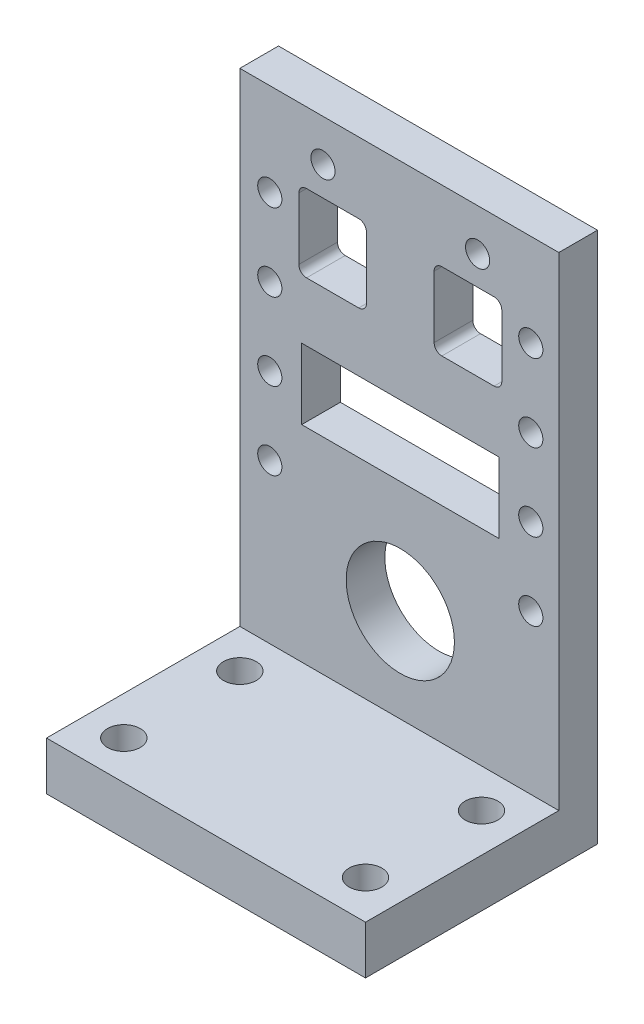
from build123d import *

# Parameters (mm, degrees)
SKETCH1_W                    = 33
SKETCH1_H                    = 55
BOSS_EXTRUDE1_DEPTH          = 4
SKETCH2_W                    = 33
SKETCH2_H                    = 5
BOSS_EXTRUDE2_DEPTH          = 20
CUT_EXTRUDE1_REACH           = 69.186
SKETCH3_R                    = 1.25
SKETCH3_R_2                  = 5.6
M3_START                     = -55
M3_CLEARANCE_HOLE1_OUTLINE_R = 1.7
M3_CLEARANCE_HOLE1_DEPTH     = 5


# Read off the part's stored shape, not the designer's step: M3 Clearance Hole1
with BuildPart() as part:
    # Sketch1 → Boss-Extrude1 (new body)
    with BuildSketch(Plane.XY):
        with Locations((16.5, -27.5)):
            Rectangle(SKETCH1_W, SKETCH1_H)
    extrude(amount=BOSS_EXTRUDE1_DEPTH)

    # Sketch2 → Boss-Extrude2 (add)
    with BuildSketch(Plane.XY.offset(4)):
        with Locations((16.5, -52.5)):
            Rectangle(SKETCH2_W, SKETCH2_H)
    extrude(amount=BOSS_EXTRUDE2_DEPTH)

    # Sketch3 → Cut-Extrude1 (cut, up to next)
    with BuildSketch(Plane.XY.offset(4), mode=Mode.PRIVATE) as cut_extrude1_sk1:
        with Locations((30.1, -9.57)):
            Circle(SKETCH3_R)
    cut_extrude1_tool1 = extrude(cut_extrude1_sk1.sketch, amount=-CUT_EXTRUDE1_REACH, mode=Mode.PRIVATE) & part.part
    # Sketch3 → Cut-Extrude1 (cut, up to next)
    with BuildSketch(Plane.XY.offset(4), mode=Mode.PRIVATE) as cut_extrude1_sk2:
        with Locations((30.1, -17.57)):
            Circle(SKETCH3_R)
    cut_extrude1_tool2 = extrude(cut_extrude1_sk2.sketch, amount=-CUT_EXTRUDE1_REACH, mode=Mode.PRIVATE) & part.part
    # Sketch3 → Cut-Extrude1 (cut, up to next)
    with BuildSketch(Plane.XY.offset(4), mode=Mode.PRIVATE) as cut_extrude1_sk3:
        with Locations((30.1, -25.57)):
            Circle(SKETCH3_R)
    cut_extrude1_tool3 = extrude(cut_extrude1_sk3.sketch, amount=-CUT_EXTRUDE1_REACH, mode=Mode.PRIVATE) & part.part
    # Sketch3 → Cut-Extrude1 (cut, up to next)
    with BuildSketch(Plane.XY.offset(4), mode=Mode.PRIVATE) as cut_extrude1_sk4:
        with Locations((30.1, -33.57)):
            Circle(SKETCH3_R)
    cut_extrude1_tool4 = extrude(cut_extrude1_sk4.sketch, amount=-CUT_EXTRUDE1_REACH, mode=Mode.PRIVATE) & part.part
    # Sketch3 → Cut-Extrude1 (cut, up to next)
    with BuildSketch(Plane.XY.offset(4), mode=Mode.PRIVATE) as cut_extrude1_sk5:
        with Locations((3.1, -33.57)):
            Circle(SKETCH3_R)
    cut_extrude1_tool5 = extrude(cut_extrude1_sk5.sketch, amount=-CUT_EXTRUDE1_REACH, mode=Mode.PRIVATE) & part.part
    # Sketch3 → Cut-Extrude1 (cut, up to next)
    with BuildSketch(Plane.XY.offset(4), mode=Mode.PRIVATE) as cut_extrude1_sk6:
        with Locations((3.1, -25.57)):
            Circle(SKETCH3_R)
    cut_extrude1_tool6 = extrude(cut_extrude1_sk6.sketch, amount=-CUT_EXTRUDE1_REACH, mode=Mode.PRIVATE) & part.part
    # Sketch3 → Cut-Extrude1 (cut, up to next)
    with BuildSketch(Plane.XY.offset(4), mode=Mode.PRIVATE) as cut_extrude1_sk7:
        with Locations((3.1, -17.57)):
            Circle(SKETCH3_R)
    cut_extrude1_tool7 = extrude(cut_extrude1_sk7.sketch, amount=-CUT_EXTRUDE1_REACH, mode=Mode.PRIVATE) & part.part
    # Sketch3 → Cut-Extrude1 (cut, up to next)
    with BuildSketch(Plane.XY.offset(4), mode=Mode.PRIVATE) as cut_extrude1_sk8:
        with Locations((3.1, -9.57)):
            Circle(SKETCH3_R)
    cut_extrude1_tool8 = extrude(cut_extrude1_sk8.sketch, amount=-CUT_EXTRUDE1_REACH, mode=Mode.PRIVATE) & part.part
    # Sketch3 → Cut-Extrude1 (cut, up to next)
    with BuildSketch(Plane.XY.offset(4), mode=Mode.PRIVATE) as cut_extrude1_sk9:
        with Locations((8.6, -4.32)):
            Circle(SKETCH3_R)
    cut_extrude1_tool9 = extrude(cut_extrude1_sk9.sketch, amount=-CUT_EXTRUDE1_REACH, mode=Mode.PRIVATE) & part.part
    # Sketch3 → Cut-Extrude1 (cut, up to next)
    with BuildSketch(Plane.XY.offset(4), mode=Mode.PRIVATE) as cut_extrude1_sk10:
        with Locations((24.6, -4.32)):
            Circle(SKETCH3_R)
    cut_extrude1_tool10 = extrude(cut_extrude1_sk10.sketch, amount=-CUT_EXTRUDE1_REACH, mode=Mode.PRIVATE) & part.part
    # Sketch3 → Cut-Extrude1 (cut, up to next)
    with BuildSketch(Plane.XY.offset(4), mode=Mode.PRIVATE) as cut_extrude1_sk11:
        with Locations((16.6, -40.32)):
            Circle(SKETCH3_R_2)
    cut_extrude1_tool11 = extrude(cut_extrude1_sk11.sketch, amount=-CUT_EXTRUDE1_REACH, mode=Mode.PRIVATE) & part.part
    # Sketch3 → Cut-Extrude1 (cut, up to next)
    with BuildSketch(Plane.XY.offset(4), mode=Mode.PRIVATE) as cut_extrude1_sk12:
        with BuildLine():
            Line((6.9, -15.32), (12.3, -15.32))
            ThreePointArc((12.3, -15.32), (12.865685425, -15.085685425), (13.1, -14.52))
            Line((13.1, -14.52), (13.1, -8.12))
            ThreePointArc((13.1, -8.12), (12.865685425, -7.554314575), (12.3, -7.32))
            Line((12.3, -7.32), (6.9, -7.32))
            ThreePointArc((6.9, -7.32), (6.334314575, -7.554314575), (6.1, -8.12))
            Line((6.1, -8.12), (6.1, -14.52))
            ThreePointArc((6.1, -14.52), (6.334314575, -15.085685425), (6.9, -15.32))
        make_face()
    cut_extrude1_tool12 = extrude(cut_extrude1_sk12.sketch, amount=-CUT_EXTRUDE1_REACH, mode=Mode.PRIVATE) & part.part
    # Sketch3 → Cut-Extrude1 (cut, up to next)
    with BuildSketch(Plane.XY.offset(4), mode=Mode.PRIVATE) as cut_extrude1_sk13:
        with BuildLine():
            Line((27.1, -8.12), (27.1, -14.52))
            ThreePointArc((27.1, -14.52), (26.865685425, -15.085685425), (26.3, -15.32))
            Line((26.3, -15.32), (20.9, -15.32))
            ThreePointArc((20.9, -15.32), (20.334314575, -15.085685425), (20.1, -14.52))
            Line((20.1, -14.52), (20.1, -8.12))
            ThreePointArc((20.1, -8.12), (20.334314575, -7.554314575), (20.9, -7.32))
            Line((20.9, -7.32), (26.3, -7.32))
            ThreePointArc((26.3, -7.32), (26.865685425, -7.554314575), (27.1, -8.12))
        make_face()
    cut_extrude1_tool13 = extrude(cut_extrude1_sk13.sketch, amount=-CUT_EXTRUDE1_REACH, mode=Mode.PRIVATE) & part.part
    # Sketch3 → Cut-Extrude1 (cut, up to next)
    with BuildSketch(Plane.XY.offset(4), mode=Mode.PRIVATE) as cut_extrude1_sk14:
        Polygon((6.4, -21.42), (16.5, -21.42), (16.7, -21.42), (26.8, -21.42), (26.8, -28.72), (16.7, -28.72), (16.5, -28.72), (6.4, -28.72), align=None)
    cut_extrude1_tool14 = extrude(cut_extrude1_sk14.sketch, amount=-CUT_EXTRUDE1_REACH, mode=Mode.PRIVATE) & part.part
    add(cut_extrude1_tool1.solids().sort_by_distance((30.1, -9.57, 4))[0], mode=Mode.SUBTRACT)
    add(cut_extrude1_tool2.solids().sort_by_distance((30.1, -17.57, 4))[0], mode=Mode.SUBTRACT)
    add(cut_extrude1_tool3.solids().sort_by_distance((30.1, -25.57, 4))[0], mode=Mode.SUBTRACT)
    add(cut_extrude1_tool4.solids().sort_by_distance((30.1, -33.57, 4))[0], mode=Mode.SUBTRACT)
    add(cut_extrude1_tool5.solids().sort_by_distance((3.1, -33.57, 4))[0], mode=Mode.SUBTRACT)
    add(cut_extrude1_tool6.solids().sort_by_distance((3.1, -25.57, 4))[0], mode=Mode.SUBTRACT)
    add(cut_extrude1_tool7.solids().sort_by_distance((3.1, -17.57, 4))[0], mode=Mode.SUBTRACT)
    add(cut_extrude1_tool8.solids().sort_by_distance((3.1, -9.57, 4))[0], mode=Mode.SUBTRACT)
    add(cut_extrude1_tool9.solids().sort_by_distance((8.6, -4.32, 4))[0], mode=Mode.SUBTRACT)
    add(cut_extrude1_tool10.solids().sort_by_distance((24.6, -4.32, 4))[0], mode=Mode.SUBTRACT)
    add(cut_extrude1_tool11.solids().sort_by_distance((16.6, -40.32, 4))[0], mode=Mode.SUBTRACT)
    add(cut_extrude1_tool12.solids().sort_by_distance((9.6, -11.32, 4))[0], mode=Mode.SUBTRACT)
    add(cut_extrude1_tool13.solids().sort_by_distance((23.6, -11.32, 4))[0], mode=Mode.SUBTRACT)
    add(cut_extrude1_tool14.solids().sort_by_distance((16.6, -25.07, 4))[0], mode=Mode.SUBTRACT)

    # M3 Clearance Hole1 outline → M3 Clearance Hole1 (cut)
    with BuildSketch(Plane(origin=(0, 0, 0), x_dir=(1, 0, 0), z_dir=(0, 1, 0)).offset(M3_START)):
        with Locations((29, -8)):
            Circle(M3_CLEARANCE_HOLE1_OUTLINE_R)
        with Locations((4, -20)):
            Circle(M3_CLEARANCE_HOLE1_OUTLINE_R)
        with Locations((29, -20)):
            Circle(M3_CLEARANCE_HOLE1_OUTLINE_R)
        with Locations((4, -8)):
            Circle(M3_CLEARANCE_HOLE1_OUTLINE_R)
    extrude(amount=M3_CLEARANCE_HOLE1_DEPTH, mode=Mode.SUBTRACT)


solid = part.part
